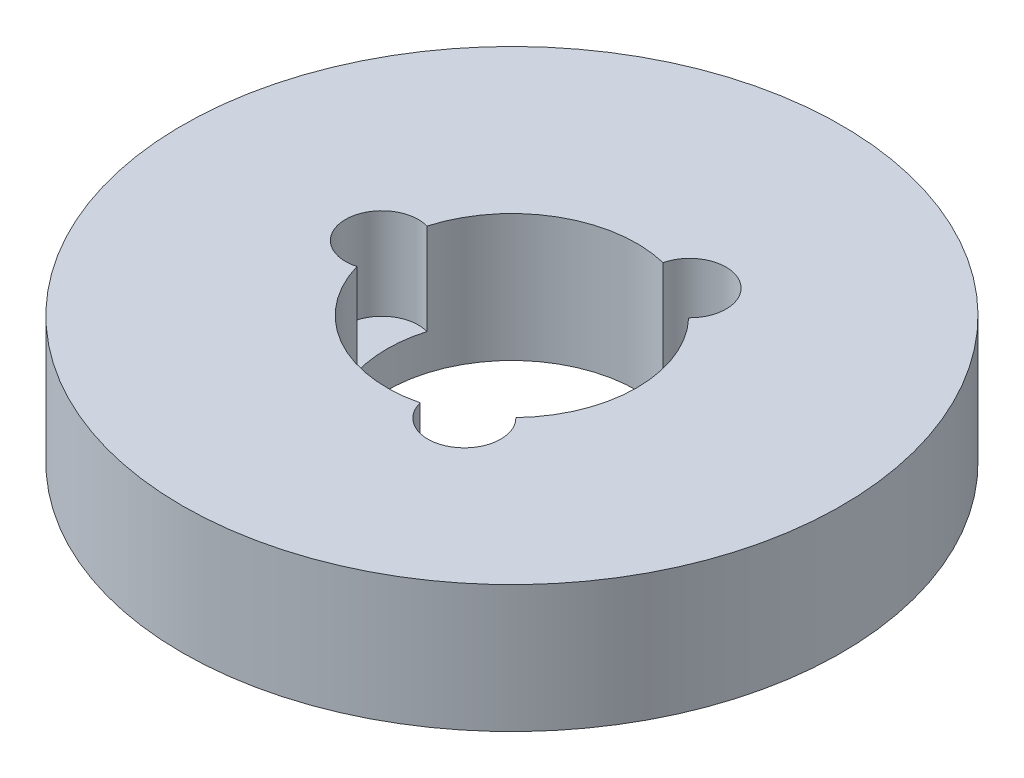
from build123d import *

# Parameters (mm, degrees)
SKETCH1_R           = 72.5
BOSS_EXTRUDE1_DEPTH = 28
SKETCH2_R           = 27.5
CUT_EXTRUDE1_DEPTH  = 107.284994237
SKETCH3_R           = 8.015300343
CUT_EXTRUDE2_DEPTH  = 20.104505823
CIRPATTERN1_COUNT   = 3


with BuildPart() as part:
    # Sketch1 → Boss-Extrude1 (new body)
    with BuildSketch(Plane(origin=(0, 0, 0), x_dir=(1, 0, 0), z_dir=(0, 1, 0))):
        Circle(SKETCH1_R)
    extrude(amount=BOSS_EXTRUDE1_DEPTH)

    # Sketch2 → Cut-Extrude1 (cut, through all)
    with BuildSketch(Plane(origin=(0, 0, 0), x_dir=(1, 0, 0), z_dir=(0, 1, 0))):
        Circle(SKETCH2_R)
    extrude(amount=CUT_EXTRUDE1_DEPTH, mode=Mode.SUBTRACT)

    # Sketch3 → Cut-Extrude2 (cut)
    with BuildSketch(Plane(origin=(0, 28, 0), x_dir=(1, 0, 0), z_dir=(0, 1, 0))):
        with Locations((-28.611038427, 0)):
            Circle(SKETCH3_R)
    cut_extrude2 = extrude(amount=-CUT_EXTRUDE2_DEPTH, mode=Mode.SUBTRACT)

    # CirPattern1: Cut-Extrude2 ×3 about axis
    cirpattern1_axis = Axis((0, 0, 0), (0, 1, 0))
    for i in range(1, CIRPATTERN1_COUNT):
        add(cut_extrude2.rotate(cirpattern1_axis, i * 360 / CIRPATTERN1_COUNT), mode=Mode.SUBTRACT)


solid = part.part
